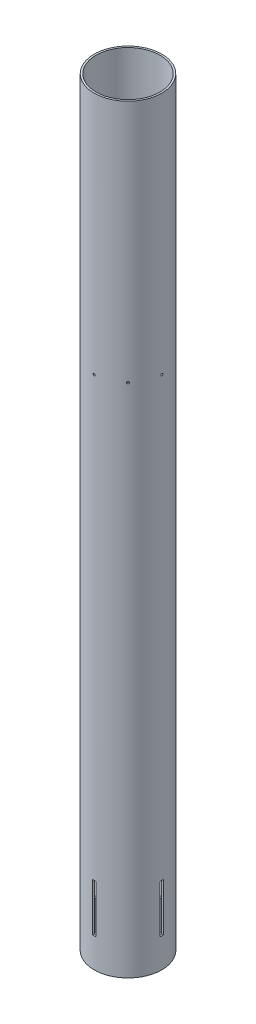
from build123d import *

# Parameters (mm, degrees)
SKETCH1_R                 = 53.721
SKETCH1_R_2               = 50.8
BODY_TUBE_EXTRUSION_DEPTH = 1206.5
ENGINE_BLOCK_HOLE_REACH   = 1214.465
SKETCH2_R                 = 1.6383
CIRPATTERN1_COUNT         = 8
FIN_TAB_SLOTS_REACH       = 1214.465
SKETCH3_W                 = 5.334
SKETCH3_H                 = 76.2
CIRPATTERN2_COUNT         = 4


with BuildPart() as part:
    # Sketch1 → Body Tube Extrusion (new body)
    with BuildSketch(Plane(origin=(0, 0, 0), x_dir=(1, 0, 0), z_dir=(0, 1, 0))):
        Circle(SKETCH1_R)
        Circle(SKETCH1_R_2, mode=Mode.SUBTRACT)
    extrude(amount=BODY_TUBE_EXTRUSION_DEPTH)

    # Sketch2 → Engine Block Hole (cut, up to next)
    with BuildSketch(Plane.XY.offset(53.721), mode=Mode.PRIVATE) as engine_block_hole_sk1:
        with Locations((0, 819.15)):
            Circle(SKETCH2_R)
    engine_block_hole_tool1 = extrude(engine_block_hole_sk1.sketch, amount=-ENGINE_BLOCK_HOLE_REACH, mode=Mode.PRIVATE) & part.part
    engine_block_hole = engine_block_hole_tool1.solids().sort_by_distance((0, 819.15, 53.721))[0]
    add(engine_block_hole, mode=Mode.SUBTRACT)

    # CirPattern1: Engine Block Hole ×8 about axis
    cirpattern1_axis = Axis((0, 1206.5, 0), (0, -1, 0))
    for i in range(1, CIRPATTERN1_COUNT):
        add(engine_block_hole.rotate(cirpattern1_axis, i * 360 / CIRPATTERN1_COUNT), mode=Mode.SUBTRACT)

    # Sketch3 → Fin Tab Slots (cut, up to next)
    with BuildSketch(Plane.XY.offset(53.721), mode=Mode.PRIVATE) as fin_tab_slots_sk1:
        with Locations((0, 85.09)):
            Rectangle(SKETCH3_W, SKETCH3_H)
    fin_tab_slots_tool1 = extrude(fin_tab_slots_sk1.sketch, amount=-FIN_TAB_SLOTS_REACH, mode=Mode.PRIVATE) & part.part
    fin_tab_slots = fin_tab_slots_tool1.solids().sort_by_distance((0, 85.09, 53.721))[0]
    add(fin_tab_slots, mode=Mode.SUBTRACT)

    # CirPattern2: Fin Tab Slots ×4 about axis
    cirpattern2_axis = Axis((0, 1206.5, 0), (0, -1, 0))
    for i in range(1, CIRPATTERN2_COUNT):
        add(fin_tab_slots.rotate(cirpattern2_axis, i * 360 / CIRPATTERN2_COUNT), mode=Mode.SUBTRACT)


solid = part.part
